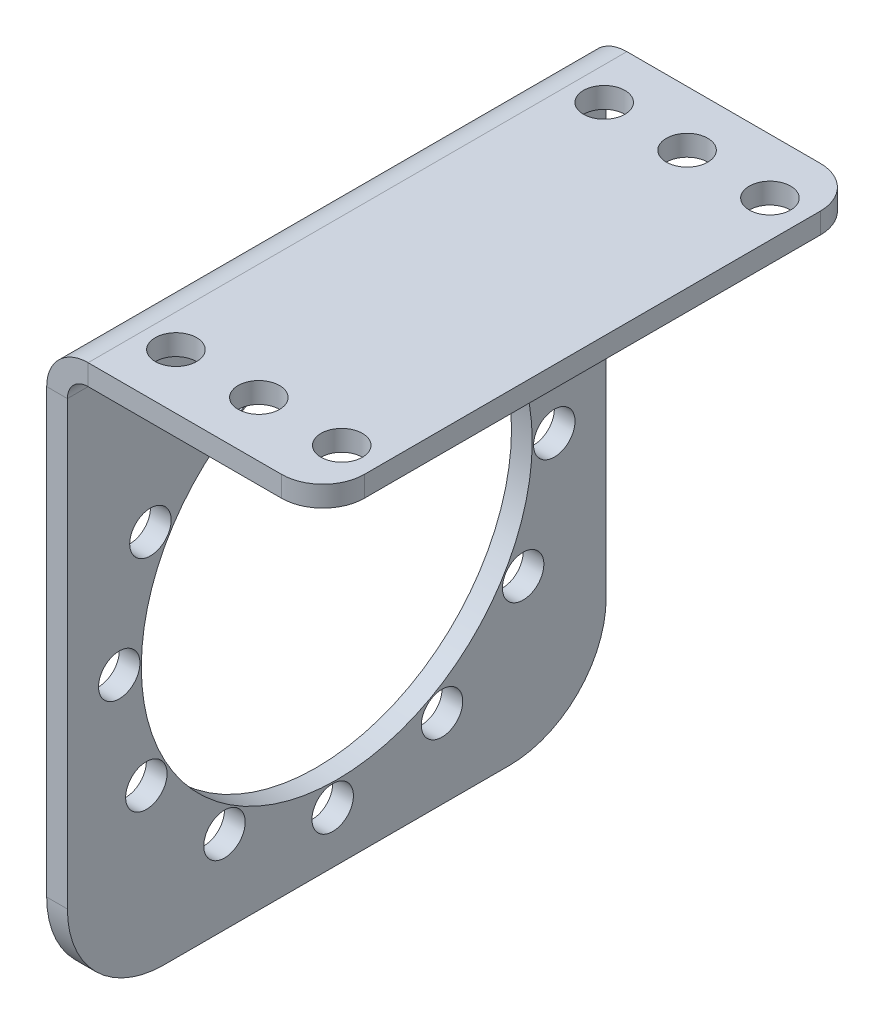
from build123d import *

# Parameters (mm, degrees)
BASE_FLANGE1_DEPTH = 39
FILLET1_R          = 7
FILLET2_R          = 3
SKETCH6_R          = 14.15
CUT_EXTRUDE1_DEPTH = 10
SKETCH12_R         = 1.5
CUT_EXTRUDE2_DEPTH = 10
SKETCH13_R         = 1.5
CUT_EXTRUDE3_DEPTH = 10


# Sheet-metal steps are written as plain solids
with BuildPart() as part:
    # Sketch1 → Base-Flange1 (new body)
    with BuildSketch(Plane.XY):
        with BuildLine():
            Line((-31.36010038, -13.579909031), (-31.36010038, 25.420090969))
            ThreePointArc((-31.36010038, 25.420090969), (-30.481420723, 27.541411313), (-28.36010038, 28.420090969))
            Line((-28.36010038, 28.420090969), (-11.36010038, 28.420090969))
            Line((-11.36010038, 28.420090969), (-11.36010038, 26.920090969))
            Line((-11.36010038, 26.920090969), (-28.36010038, 26.920090969))
            ThreePointArc((-28.36010038, 26.920090969), (-29.420760552, 26.480751141), (-29.86010038, 25.420090969))
            Line((-29.86010038, 25.420090969), (-29.86010038, -13.579909031))
            Line((-29.86010038, -13.579909031), (-31.36010038, -13.579909031))
        make_face()
    extrude(amount=BASE_FLANGE1_DEPTH)

    # Fillet1
    fillet1_edges = [part.edges().sort_by_distance(p)[0] for p in [
        (-30.61010038, -13.579909031, 39),
        (-30.61010038, -13.579909031, 0),
    ]]
    fillet(fillet1_edges, radius=FILLET1_R)

    # Fillet2
    fillet2_edges = [part.edges().sort_by_distance(p)[0] for p in [
        (-11.36010038, 27.670090969, 39),
        (-11.36010038, 27.670090969, 0),
    ]]
    fillet(fillet2_edges, radius=FILLET2_R)

    # Sketch6 → Cut-Extrude1 (cut)
    with BuildSketch(Plane.ZY.offset(31.36010038)):
        with Locations((19.5, 5.920090969)):
            Circle(SKETCH6_R)
    extrude(amount=-CUT_EXTRUDE1_DEPTH, mode=Mode.SUBTRACT)

    # Sketch12 → Cut-Extrude2 (cut)
    with BuildSketch(Plane.ZY.offset(31.36010038)):
        with Locations((19.204809579, 21.670090969)):
            Circle(SKETCH12_R)
        with Locations((27.117967884, 19.707930885)):
            Circle(SKETCH12_R)
        with Locations((32.989883957, 14.052071253)):
            Circle(SKETCH12_R)
        with Locations((35.24718263, 6.217995095)):
            Circle(SKETCH12_R)
        with Locations((33.285022545, -1.695163209)):
            Circle(SKETCH12_R)
        with Locations((27.629162914, -7.567079283)):
            Circle(SKETCH12_R)
        with Locations((19.795086756, -9.824377956)):
            Circle(SKETCH12_R)
        with Locations((11.881928451, -7.862217871)):
            Circle(SKETCH12_R)
        with Locations((6.010012378, -2.206358239)):
            Circle(SKETCH12_R)
        with Locations((3.752713705, 5.627717919)):
            Circle(SKETCH12_R)
        with Locations((5.71487379, 13.540876223)):
            Circle(SKETCH12_R)
        with Locations((11.370733421, 19.412792296)):
            Circle(SKETCH12_R)
    extrude(amount=-CUT_EXTRUDE2_DEPTH, mode=Mode.SUBTRACT)

    # Sketch13 → Cut-Extrude3 (cut)
    with BuildSketch(Plane(origin=(0, 28.420090969, 0), x_dir=(1, 0, 0), z_dir=(0, 1, 0))):
        with Locations(Location((-26.002140867, -4, 0), (0, 0, 270))):
            Circle(SKETCH13_R)
        with Locations(Location((-20.002140867, -4, 0), (0, 0, 270))):
            Circle(SKETCH13_R)
        with Locations(Location((-14.002140867, -4, 0), (0, 0, 270))):
            Circle(SKETCH13_R)
        with Locations(Location((-20.002140867, -35, 0), (0, 0, 270))):
            Circle(SKETCH13_R)
        with Locations(Location((-14.002140867, -35, 0), (0, 0, 270))):
            Circle(SKETCH13_R)
        with Locations(Location((-26.002140867, -35, 0), (0, 0, 270))):
            Circle(SKETCH13_R)
    extrude(amount=-CUT_EXTRUDE3_DEPTH, mode=Mode.SUBTRACT)


solid = part.part
